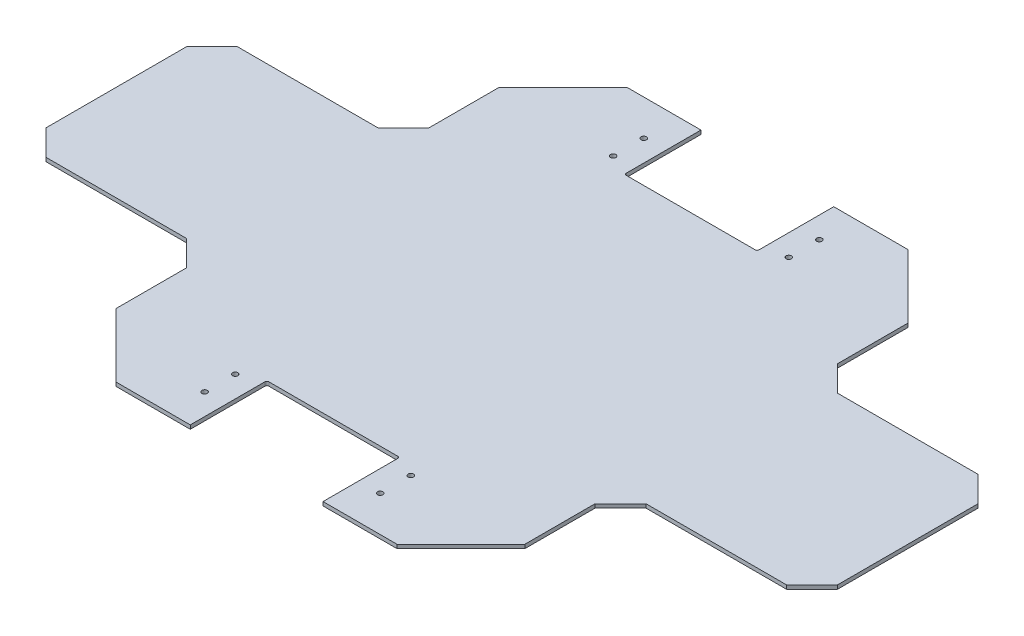
from build123d import *

# Parameters (mm, degrees)
EXTRUDE_1_DEPTH     = 3
CHAMFER_1_SIZE      = 20
CHAMFER_2_SIZE      = 50
SKETCH_2_W          = 104
SKETCH_2_H          = 93.088788678
CUT_EXTRUDE_1_DEPTH = 40
FILLET_1_R          = 1.5
SKETCH_3_R          = 2.1
CUT_EXTRUDE_2_DEPTH = 80


with BuildPart() as part:
    # 草图1 → 凸台-拉伸1 (new body)
    with BuildSketch(Plane(origin=(0, 0, 0), x_dir=(1, 0, 0), z_dir=(0, 1, 0))):
        Polygon((-310, -75), (-160, -75), (-160, -200), (160, -200), (160, -75), (310, -75), (310, 75), (160, 75), (160, 200), (-160, 200), (-160, 75), (-310, 75), align=None)
    extrude(amount=EXTRUDE_1_DEPTH)

    # 倒角1
    chamfer_1_edges = [part.edges().sort_by_distance(p)[0] for p in [
        (-160, 1.5, -75),
        (-310, 1.5, -75),
        (-310, 1.5, 75),
        (-160, 1.5, 75),
        (160, 1.5, 75),
        (160, 1.5, -75),
        (310, 1.5, 75),
        (310, 1.5, -75),
    ]]
    chamfer(chamfer_1_edges, length=CHAMFER_1_SIZE)

    # 倒角2
    chamfer_2_edges = [part.edges().sort_by_distance(p)[0] for p in [
        (160, 1.5, 200),
        (-160, 1.5, 200),
        (160, 1.5, -200),
        (-160, 1.5, -200),
    ]]
    chamfer(chamfer_2_edges, length=CHAMFER_2_SIZE)

    # 草图2 → 切除-拉伸1 (cut)
    with BuildSketch(Plane(origin=(0, 0, 0), x_dir=(-1, 0, 0), z_dir=(0, -1, 0))):
        with Locations((0, -186.544394339)):
            Rectangle(SKETCH_2_W, SKETCH_2_H)
        with Locations((0, 186.544394339)):
            Rectangle(SKETCH_2_W, SKETCH_2_H)
    extrude(amount=-CUT_EXTRUDE_1_DEPTH, mode=Mode.SUBTRACT)

    # 圆角1
    fillet_1_edges = [part.edges().sort_by_distance(p)[0] for p in [
        (-52, 1.5, -140),
        (52, 1.5, -140),
        (52, 1.5, 140),
        (-52, 1.5, 140),
    ]]
    fillet(fillet_1_edges, radius=FILLET_1_R)

    # 草图3 → 切除-拉伸2 (cut)
    with BuildSketch(Plane.XZ):
        with Locations((-68.75, 172)):
            Circle(SKETCH_3_R)
        with Locations((-68.75, 148)):
            Circle(SKETCH_3_R)
        with Locations((68.75, 172)):
            Circle(SKETCH_3_R)
        with Locations((68.75, 148)):
            Circle(SKETCH_3_R)
        with Locations((-68.75, -148)):
            Circle(SKETCH_3_R)
        with Locations((-68.75, -172)):
            Circle(SKETCH_3_R)
        with Locations((68.75, -148)):
            Circle(SKETCH_3_R)
        with Locations((68.75, -172)):
            Circle(SKETCH_3_R)
    extrude(amount=-CUT_EXTRUDE_2_DEPTH, mode=Mode.SUBTRACT)


solid = part.part
